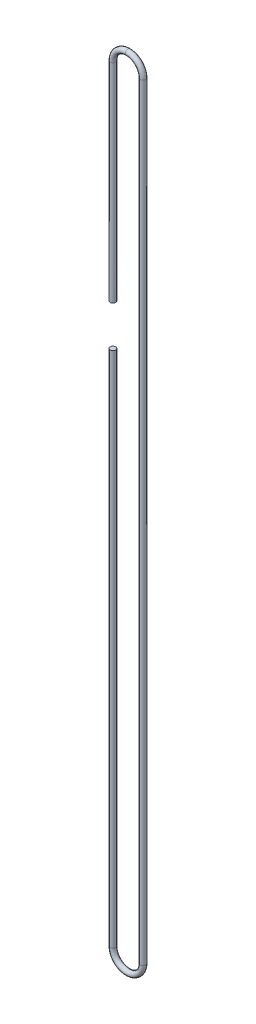
from build123d import *

# Parameters (mm, degrees)
SKETCH2_R               = 3.175
CUT_EXTRUDE1_DEPTH      = 910.877117321
CUT_EXTRUDE1_DEPTH_BACK = 910.877117321
SKETCH3_W               = 36.037797304
SKETCH3_H               = 47.625


with BuildPart() as part:
    # Sweep1: sweep along a path in Sketch1
    with BuildLine(Plane.XY) as sweep1_path:
        Line((-17.4625, 889), (-17.4625, 0))
        ThreePointArc((-17.4625, 0), (0, -17.4625), (17.4625, 0))
        Line((17.4625, 0), (17.4625, 889))
        ThreePointArc((17.4625, 889), (0, 906.4625), (-17.4625, 889))
    # Sketch2 → Sweep1 (sweep)
    with BuildSketch(Plane(origin=(0, 0, 0), x_dir=(0, 0, -1), z_dir=(1, 0, 0))):
        with Locations((0, 906.4625)):
            Circle(SKETCH2_R)
    sweep(path=sweep1_path.line)

    # Sketch3 → Cut-Extrude1 (cut, two sides: drawn at the far end of the back side and taken through both)
    with BuildSketch(Plane.XY.offset(-CUT_EXTRUDE1_DEPTH_BACK)):
        with Locations((-20.239587833, 623.8875)):
            Rectangle(SKETCH3_W, SKETCH3_H)
    extrude(amount=CUT_EXTRUDE1_DEPTH + CUT_EXTRUDE1_DEPTH_BACK, mode=Mode.SUBTRACT)


solid = part.part
